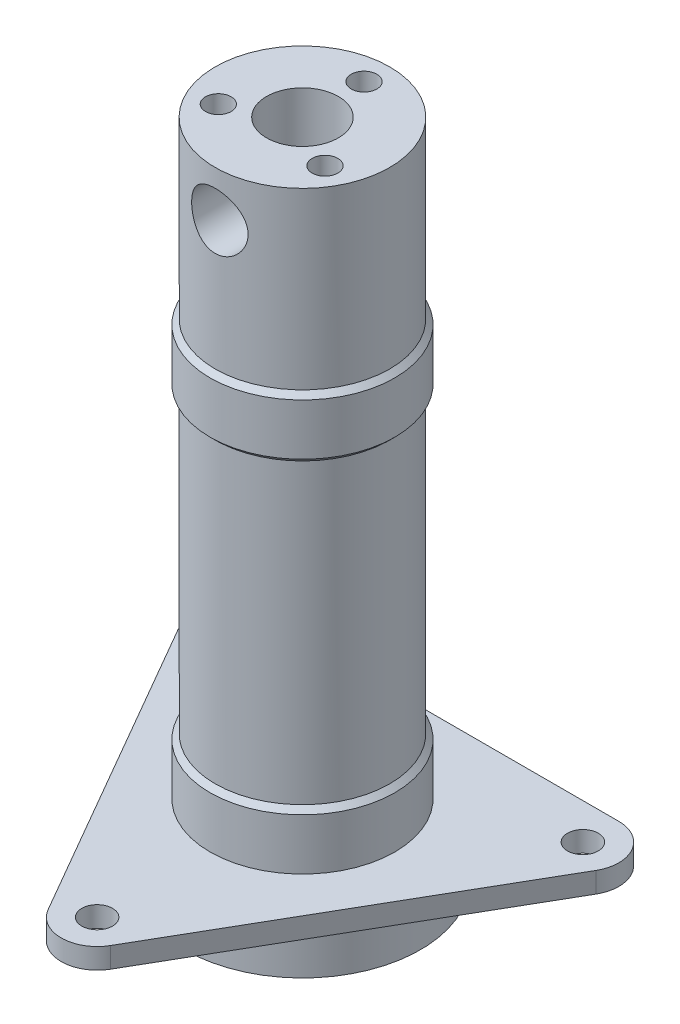
from build123d import *

# Parameters (mm, degrees)
CHAMFER_1_SIZE         = 0.5
CHAMFER_2_SIZE         = 1
SKETCH_9_OUTSIDE_W     = 67.524
SKETCH_9_OUTSIDE_H     = 67.524
SKETCH_9_OUTSIDE_R     = 1.5
CUT_EXTRUDE_2_DEPTH    = 69.152402746
HOLE_WIZARD_M3_1_D     = 2.5
HOLE_WIZARD_M3_1_DEPTH = 5
HOLE_WIZARD_M3_1_TIP   = 0.751075774
HOLE_WIZARD_M3_2_D     = 2.5
HOLE_WIZARD_M3_2_DEPTH = 6.5
HOLE_WIZARD_M3_2_TIP   = 0.751075774
SKETCH_11_R            = 2.75
CUT_EXTRUDE_4_DEPTH    = 68.275504878


with BuildPart() as part:
    # 草图2 → 旋转1 (revolve)
    with BuildSketch(Plane.XY, mode=Mode.PRIVATE) as revolve_1_sk:
        Polygon((9, 2), (9, 7), (8.5, 7), (8.5, 37), (9, 37), (9, 42), (8.5, 42), (8.5, 59.5), (3.5, 59.5), (3.5, 51), (6.5, 48), (6.5, -5), (11.5, -5), (11.5, 0), (23.5, 0), (23.5, 2), align=None)
    revolve(revolve_1_sk.sketch.rotate(Axis((0, 0, 0), (0, 1, 0)), 90), axis=Axis((0, 0, 0), (0, 1, 0)))

    # 倒角1
    chamfer_1_edges = [part.edges().sort_by_distance(p)[0] for p in [
        (0, 7, 8.5),
        (0, 37, 8.5),
        (0, 42, 8.5),
    ]]
    chamfer(chamfer_1_edges, length=CHAMFER_1_SIZE - 0.0001)  # a hair under: the kernel refuses the full size

    # 倒角2
    chamfer_2_edges = [part.edges().sort_by_distance(p)[0] for p in [
        (0, 0, 11.5),
    ]]
    chamfer(chamfer_2_edges, length=CHAMFER_2_SIZE)

    # 草图9 outside → 切除-拉伸2 (cut, through all)
    # profile 1 of 4: a face of its own
    with BuildSketch(Plane.XZ):
        Rectangle(SKETCH_9_OUTSIDE_W, SKETCH_9_OUTSIDE_H)
        with BuildLine():
            Line((-3.031088913, 21.75), (-20.351596989, -8.25))
            ThreePointArc((-20.351596989, -8.25), (-20.351596989, -11.75), (-17.320508076, -13.5))
            Line((-17.320508076, -13.5), (17.320508076, -13.5))
            ThreePointArc((17.320508076, -13.5), (20.351596989, -11.75), (20.351596989, -8.25))
            Line((20.351596989, -8.25), (3.031088913, 21.75))
            ThreePointArc((3.031088913, 21.75), (0, 23.5), (-3.031088913, 21.75))
        make_face(mode=Mode.SUBTRACT)
    # profile 2 of 4: a face of its own
    with BuildSketch(Plane.XZ):
        with Locations(Location((0, 20, 0), (0, 0, 270))):
            Circle(SKETCH_9_OUTSIDE_R)
    # profile 3 of 4: a face of its own
    with BuildSketch(Plane.XZ):
        with Locations(Location((17.320508076, -10, 0), (0, 0, 270))):
            Circle(SKETCH_9_OUTSIDE_R)
    # profile 4 of 4: a face of its own
    with BuildSketch(Plane.XZ):
        with Locations(Location((-17.320508076, -10, 0), (0, 0, 270))):
            Circle(SKETCH_9_OUTSIDE_R)
    extrude(amount=-CUT_EXTRUDE_2_DEPTH, mode=Mode.SUBTRACT)

    # M3 螺纹孔1
    with Locations(Plane.XZ.offset(5)):
        with Locations((0, -9), (7.794228634, 4.5), (-7.794228634, 4.5)):
            Hole(HOLE_WIZARD_M3_1_D / 2, depth=HOLE_WIZARD_M3_1_DEPTH)
            with Locations((0, 0, -(HOLE_WIZARD_M3_1_DEPTH + HOLE_WIZARD_M3_1_TIP / 2))):  # 118° drill point
                Cone(0, HOLE_WIZARD_M3_1_D / 2, HOLE_WIZARD_M3_1_TIP, mode=Mode.SUBTRACT)

    # M3 螺纹孔2
    with Locations(Plane(origin=(0, 59.5, 0), x_dir=(1, 0, 0), z_dir=(0, 1, 0))):
        with Locations((0, 6), (5.196152423, -3), (-5.196152423, -3)):
            Hole(HOLE_WIZARD_M3_2_D / 2, depth=HOLE_WIZARD_M3_2_DEPTH)
            with Locations((0, 0, -(HOLE_WIZARD_M3_2_DEPTH + HOLE_WIZARD_M3_2_TIP / 2))):  # 118° drill point
                Cone(0, HOLE_WIZARD_M3_2_D / 2, HOLE_WIZARD_M3_2_TIP, mode=Mode.SUBTRACT)

    # 草图11 → 切除-拉伸4 (cut, through all)
    with BuildSketch(Plane.XY):
        with Locations(Location((0, 55, 0), (0, 0, 180))):
            Circle(SKETCH_11_R)
    extrude(amount=CUT_EXTRUDE_4_DEPTH, mode=Mode.SUBTRACT)


solid = part.part
